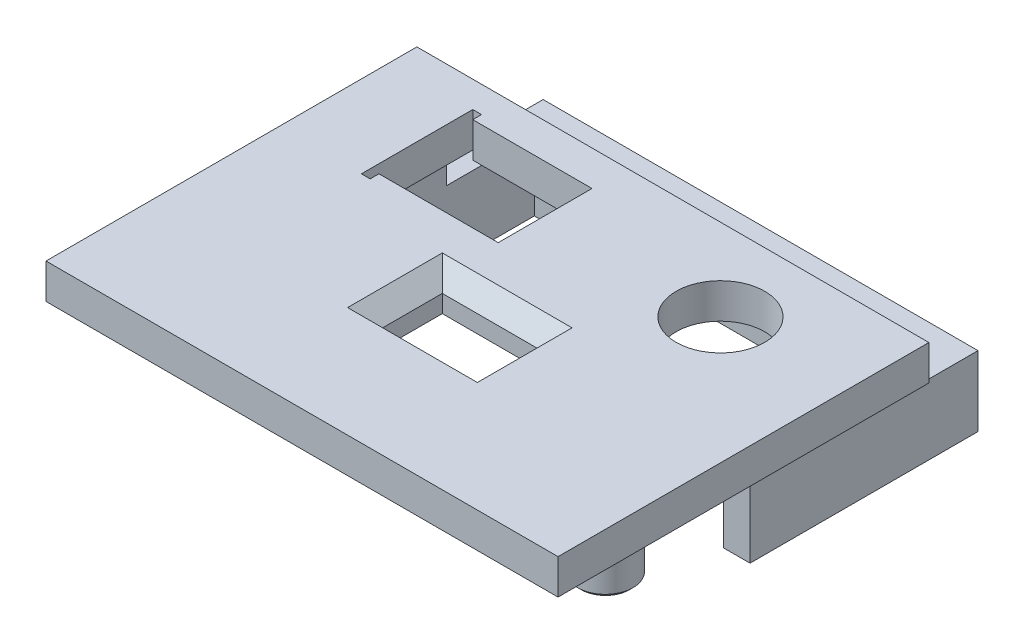
from build123d import *

# Parameters (mm, degrees)
PARTS_W             = 29.2
PARTS_H             = 21.15
MAIN_FACE_DEPTH     = 2
SKETCH3_R           = 2.525
IR_CUT_DEPTH        = 2
TSOP_GROOVE_DEPTH   = 1.5
SKETCH4_W           = 5.4
SKETCH4_H           = 3.4
TOF_CUT_DEPTH       = 2
SKETCH6_R           = 1.575
SHAFTS_DEPTH        = 5
CHAMFER1_SIZE       = 0.2
SKETCH7_W           = 15
SKETCH7_H           = 3.5
PINSLOTS_DEPTH      = 1
TOFWINDOW_SIZE      = 1
SKETCH8_W           = 1.5
SKETCH8_H           = 6
BOSS_EXTRUDE1_DEPTH = 6
SKETCH14_W          = 1.5
SKETCH14_H          = 4
BOSS_EXTRUDE4_DEPTH = 5
SKETCH15_W          = 24.8
SKETCH15_H          = 4
BOSS_EXTRUDE5_DEPTH = 2
CUT_EXTRUDE4_REACH  = 31.332
SKETCH16_R          = 1
CUT_EXTRUDE5_START  = -0.5
CUT_EXTRUDE5_DEPTH  = 0.5
FILLET1_R           = 0.5


with BuildPart() as part:
    # Parts → Main Face (new body)
    with BuildSketch(Plane(origin=(0, 0, 0), x_dir=(1, 0, 0), z_dir=(0, 1, 0))):
        with Locations((0, 3.175)):
            Rectangle(PARTS_W, PARTS_H)
    extrude(amount=-MAIN_FACE_DEPTH)

    # Sketch3 → IR Cut (cut)
    with BuildSketch(Plane(origin=(0, 0, 0), x_dir=(1, 0, 0), z_dir=(0, 1, 0))):
        with Locations(Location((7.3875, 9.075, 0), (0, 0, 270))):
            Circle(SKETCH3_R)
        Polygon((-2.6125, 11.75), (-2.6125, 6.4), (-9.4125, 6.4), (-9.4125, 5.9), (-9.9125, 5.9), (-9.9125, 6.4), (-9.9125, 11.75), (-9.9125, 12.25), (-9.4125, 12.25), (-9.4125, 11.75), align=None)
    extrude(amount=-IR_CUT_DEPTH, mode=Mode.SUBTRACT)

    # Sketch5 → TSOP Groove (cut)
    with BuildSketch(Plane.XZ.offset(2)):
        Polygon((-2.6125, -11.75), (-2.6125, -6.4), (-2.6125, -5.9), (1.3875, -5.9), (1.3875, -6.4), (1.3875, -11.75), (1.3875, -12.25), (-2.6125, -12.25), align=None)
    extrude(amount=-TSOP_GROOVE_DEPTH, mode=Mode.SUBTRACT)

    # Sketch4 → TOF Cut (cut)
    with BuildSketch(Plane(origin=(0, 0, 0), x_dir=(1, 0, 0), z_dir=(0, 1, 0))):
        with Locations((0, 1.6)):
            Rectangle(SKETCH4_W, SKETCH4_H)
    extrude(amount=-TOF_CUT_DEPTH, mode=Mode.SUBTRACT)

    # Sketch6 → Shafts (add)
    with BuildSketch(Plane.XZ.offset(2)):
        with Locations(Location((-9.9, 0, 0), (0, 0, 270))):
            Circle(SKETCH6_R)
        with Locations(Location((9.9, 0, 0), (0, 0, 270))):
            Circle(SKETCH6_R)
    extrude(amount=SHAFTS_DEPTH)

    # Chamfer1
    chamfer1_edges = [part.edges().sort_by_distance(p)[0] for p in [
        (9.9, -7, 1.575),
        (-9.9, -7, 1.575),
    ]]
    chamfer(chamfer1_edges, length=CHAMFER1_SIZE)

    # Sketch7 → PinSlots (cut)
    with BuildSketch(Plane.XZ.offset(2)):
        with Locations((0, 3.15)):
            Rectangle(SKETCH7_W, SKETCH7_H)
    extrude(amount=-PINSLOTS_DEPTH, mode=Mode.SUBTRACT)

    # ToFWindow
    tofwindow_edges = [part.edges().sort_by_distance(p)[0] for p in [
        (-2.7, 0, -1.6),
        (0, 0, 0.1),
        (2.7, 0, -1.6),
        (0, 0, -3.3),
    ]]
    chamfer(tofwindow_edges, length=TOFWINDOW_SIZE)

    # Sketch8 → Boss-Extrude1 (add)
    with BuildSketch(Plane.XZ.offset(2)):
        with Locations((-11.65, -8.75)):
            Rectangle(SKETCH8_W, SKETCH8_H)
        with Locations((11.65, -8.75)):
            Rectangle(SKETCH8_W, SKETCH8_H)
    extrude(amount=BOSS_EXTRUDE1_DEPTH)

    # Sketch14 → Boss-Extrude4 (add)
    with BuildSketch(Plane(origin=(0, 0, -11.75), x_dir=(-1, 0, 0), z_dir=(0, 0, -1))):
        with Locations((-11.65, -6)):
            Rectangle(SKETCH14_W, SKETCH14_H)
        with Locations((11.65, -6)):
            Rectangle(SKETCH14_W, SKETCH14_H)
    extrude(amount=BOSS_EXTRUDE4_DEPTH)

    # Sketch15 → Boss-Extrude5 (add)
    with BuildSketch(Plane(origin=(0, 0, -16.75), x_dir=(-1, 0, 0), z_dir=(0, 0, -1))):
        with Locations((0, -6)):
            Rectangle(SKETCH15_W, SKETCH15_H)
    extrude(amount=BOSS_EXTRUDE5_DEPTH)

    # Sketch16 → Cut-Extrude4 (cut, up to next)
    with BuildSketch(Plane.XY.offset(-16.75), mode=Mode.PRIVATE) as cut_extrude4_sk1:
        with Locations((-4.5, -6)):
            Circle(SKETCH16_R)
    cut_extrude4_tool1 = extrude(cut_extrude4_sk1.sketch, amount=-CUT_EXTRUDE4_REACH, mode=Mode.PRIVATE) & part.part
    # Sketch16 → Cut-Extrude4 (cut, up to next)
    with BuildSketch(Plane.XY.offset(-16.75), mode=Mode.PRIVATE) as cut_extrude4_sk2:
        with Locations((-1.5, -6)):
            Circle(SKETCH16_R)
    cut_extrude4_tool2 = extrude(cut_extrude4_sk2.sketch, amount=-CUT_EXTRUDE4_REACH, mode=Mode.PRIVATE) & part.part
    # Sketch16 → Cut-Extrude4 (cut, up to next)
    with BuildSketch(Plane.XY.offset(-16.75), mode=Mode.PRIVATE) as cut_extrude4_sk3:
        with Locations(Location((1.5, -6, 0), (0, 0, 180))):
            Circle(SKETCH16_R)
    cut_extrude4_tool3 = extrude(cut_extrude4_sk3.sketch, amount=-CUT_EXTRUDE4_REACH, mode=Mode.PRIVATE) & part.part
    # Sketch16 → Cut-Extrude4 (cut, up to next)
    with BuildSketch(Plane.XY.offset(-16.75), mode=Mode.PRIVATE) as cut_extrude4_sk4:
        with Locations(Location((4.5, -6, 0), (0, 0, 180))):
            Circle(SKETCH16_R)
    cut_extrude4_tool4 = extrude(cut_extrude4_sk4.sketch, amount=-CUT_EXTRUDE4_REACH, mode=Mode.PRIVATE) & part.part
    add(cut_extrude4_tool1.solids().sort_by_distance((-4.5, -6, -16.75))[0], mode=Mode.SUBTRACT)
    add(cut_extrude4_tool2.solids().sort_by_distance((-1.5, -6, -16.75))[0], mode=Mode.SUBTRACT)
    add(cut_extrude4_tool3.solids().sort_by_distance((1.5, -6, -16.75))[0], mode=Mode.SUBTRACT)
    add(cut_extrude4_tool4.solids().sort_by_distance((4.5, -6, -16.75))[0], mode=Mode.SUBTRACT)

    # Sketch17 → Cut-Extrude5 (cut)
    with BuildSketch(Plane(origin=(0, 0, -18.75), x_dir=(-1, 0, 0), z_dir=(0, 0, -1)).offset(CUT_EXTRUDE5_START)):
        with BuildLine():
            Line((-5, -6.866025404), (-5, -8))
            Line((-5, -8), (-4, -8))
            Line((-4, -8), (-4, -6.866025404))
            ThreePointArc((-4, -6.866025404), (-4.5, -7), (-5, -6.866025404))
        make_face()
        with BuildLine():
            Line((-1, -8), (-1, -6.866025404))
            ThreePointArc((-1, -6.866025404), (-1.5, -7), (-2, -6.866025404))
            Line((-2, -6.866025404), (-2, -8))
            Line((-2, -8), (-1, -8))
        make_face()
        with BuildLine():
            Line((2, -8), (2, -6.866025404))
            ThreePointArc((2, -6.866025404), (1.5, -7), (1, -6.866025404))
            Line((1, -6.866025404), (1, -8))
            Line((1, -8), (2, -8))
        make_face()
        with BuildLine():
            Line((5, -8), (5, -6.866025404))
            ThreePointArc((5, -6.866025404), (4.5, -7), (4, -6.866025404))
            Line((4, -6.866025404), (4, -8))
            Line((4, -8), (5, -8))
        make_face()
    extrude(amount=CUT_EXTRUDE5_DEPTH, mode=Mode.SUBTRACT)

    # Fillet1
    fillet1_edges = [part.edges().sort_by_distance(p)[0] for p in [
        (-5, -7.433012702, -18.25),
        (-4, -7.433012702, -18.25),
        (-2, -7.433012702, -18.25),
        (-1, -7.433012702, -18.25),
        (1, -7.433012702, -18.25),
        (2, -7.433012702, -18.25),
        (4, -7.433012702, -18.25),
        (5, -7.433012702, -18.25),
    ]]
    fillet(fillet1_edges, radius=FILLET1_R - 0.0001)  # a hair under: the kernel refuses the full size


solid = part.part
